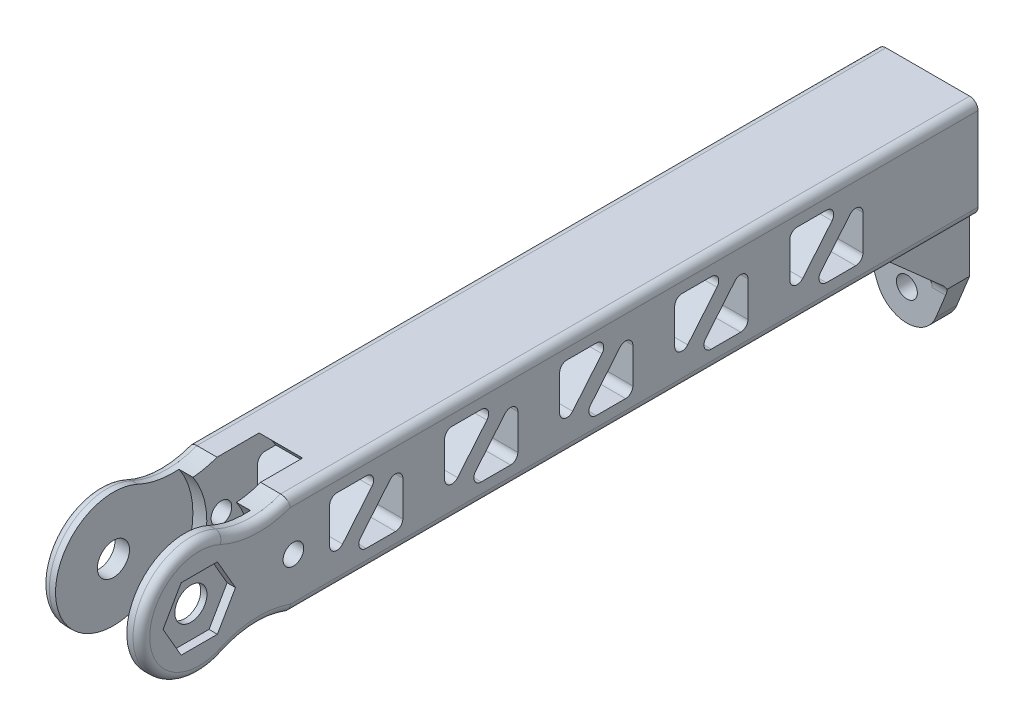
from build123d import *

# Parameters (mm, degrees)
SKETCH1_R               = 8.7884
SKETCH1_R_2             = 2.4384
SKETCH1_W               = 104.5923556
SKETCH1_H               = 15.24
BOSS_EXTRUDE1_DEPTH     = 15.24
SKETCH2_R               = 4.826
CUT_EXTRUDE1_DEPTH      = 12.7
CUT_EXTRUDE2_DEPTH      = 121.31407052
CUT_EXTRUDE2_DEPTH_BACK = 121.31407052
SKETCH3_W               = 10.8204
SKETCH3_H               = 19.05
CUT_EXTRUDE4_DEPTH      = 5.4102
CUT_EXTRUDE4_DEPTH_BACK = 5.4102
SKETCH5_R               = 12.065
CUT_EXTRUDE6_DEPTH      = 120.513496933
FILLET3_R               = 1.27
SKETCH10_W              = 12.7
SKETCH10_H              = 3.175
BOSS_EXTRUDE2_DEPTH     = 20.066
SKETCH11_R              = 1.5875
CUT_EXTRUDE7_DEPTH      = 128.794377122
CUT_EXTRUDE8_DEPTH      = 3.302
CUT_EXTRUDE8_DEPTH_BACK = 3.302
SKETCH12_R              = 9.525
CUT_EXTRUDE9_DEPTH      = 121.826660783
CUT_EXTRUDE9_DEPTH_BACK = 121.826660783
SKETCH12_3_R            = 1.56718
BOSS_EXTRUDE3_DEPTH     = 2.54
FILLET4_R               = 2.54
CUT_EXTRUDE11_DEPTH     = 1.27


with BuildPart() as part:
    # Sketch1 → Boss-Extrude1 (new body)
    # profile 1 of 3: a face of its own
    with BuildSketch(Plane(origin=(0, 0, 0), x_dir=(0, 0, -1), z_dir=(1, 0, 0))):
        Circle(SKETCH1_R)
        with Locations(Location((0, 0, 0), (0, 0, 180))):
            Circle(SKETCH1_R_2, mode=Mode.SUBTRACT)
    # profile 2 of 3: a face of its own
    with BuildSketch(Plane(origin=(0, 0, 0), x_dir=(0, 0, -1), z_dir=(1, 0, 0))):
        with BuildLine():
            Line((13.6192444, -7.62), (13.6192444, 7.62))
            ThreePointArc((13.6192444, 7.62), (8.629919404, 6.786434437), (3.71100259, 7.966456825))
            ThreePointArc((3.71100259, 7.966456825), (7.41113182, 4.723462681), (8.7884, 0))
            ThreePointArc((8.7884, 0), (7.41113182, -4.723462681), (3.71100259, -7.966456825))
            ThreePointArc((3.71100259, -7.966456825), (8.629919404, -6.786434437), (13.6192444, -7.62))
        make_face()
    # profile 3 of 3: a face of its own
    with BuildSketch(Plane(origin=(0, 0, 0), x_dir=(0, 0, -1), z_dir=(1, 0, 0))):
        with Locations((65.9154222, 0)):
            Rectangle(SKETCH1_W, SKETCH1_H)
    extrude(amount=BOSS_EXTRUDE1_DEPTH)

    # Sketch2 → Cut-Extrude1 (cut)
    with BuildSketch(Plane(origin=(0, 0, -118.2116), x_dir=(-1, 0, 0), z_dir=(0, 0, -1))):
        with Locations((-7.62, 0)):
            Circle(SKETCH2_R)
    extrude(amount=-CUT_EXTRUDE1_DEPTH, mode=Mode.SUBTRACT)

    # Sketch3 → Cut-Extrude2 (cut, two sides: drawn at the far end of the back side and taken through both)
    with BuildSketch(Plane(origin=(0, 7.62, 0), x_dir=(1, 0, 0), z_dir=(0, 1, 0)).offset(-CUT_EXTRUDE2_DEPTH_BACK)):
        with Locations((7.62, -0.6682556)):
            Rectangle(SKETCH3_W, SKETCH3_H)
    extrude(amount=CUT_EXTRUDE2_DEPTH + CUT_EXTRUDE2_DEPTH_BACK, mode=Mode.SUBTRACT)

    # Sketch5 → Cut-Extrude4 (cut, two sides: drawn at the far end of the back side and taken through both)
    with BuildSketch(Plane.ZY.offset(-7.62).offset(-CUT_EXTRUDE4_DEPTH_BACK)):
        Circle(SKETCH5_R)
    extrude(amount=CUT_EXTRUDE4_DEPTH + CUT_EXTRUDE4_DEPTH_BACK, mode=Mode.SUBTRACT)

    # Sketch6 → Cut-Extrude6 (cut, through all)
    with BuildSketch(Plane.ZY):
        with BuildLine():
            Line((-94.330479095, -2.939845086), (-98.784164103, 2.404576924))
            ThreePointArc((-98.784164103, 2.404576924), (-100.016147574, 2.7380488), (-100.7491, 1.69317201))
            Line((-100.7491, 1.69317201), (-100.7491, -3.65125))
            ThreePointArc((-100.7491, -3.65125), (-100.423622411, -4.437022411), (-99.63785, -4.7625))
            Line((-99.63785, -4.7625), (-95.184164992, -4.7625))
            ThreePointArc((-95.184164992, -4.7625), (-94.177828748, -4.122592684), (-94.330479095, -2.939845086))
        make_face()
        with BuildLine():
            ThreePointArc((-95.201535008, 4.7625), (-96.207871252, 4.122592684), (-96.055220905, 2.939845086))
            Line((-96.055220905, 2.939845086), (-91.601535897, -2.404576924))
            ThreePointArc((-91.601535897, -2.404576924), (-90.369552426, -2.7380488), (-89.6366, -1.69317201))
            Line((-89.6366, -1.69317201), (-89.6366, 3.65125))
            ThreePointArc((-89.6366, 3.65125), (-89.962077589, 4.437022411), (-90.74785, 4.7625))
            Line((-90.74785, 4.7625), (-95.201535008, 4.7625))
        make_face()
        with BuildLine():
            Line((-83.2866, 1.69317201), (-83.2866, -3.65125))
            ThreePointArc((-83.2866, -3.65125), (-82.961122411, -4.437022411), (-82.17535, -4.7625))
            Line((-82.17535, -4.7625), (-77.721664992, -4.7625))
            ThreePointArc((-77.721664992, -4.7625), (-76.715328748, -4.122592684), (-76.867979095, -2.939845086))
            Line((-76.867979095, -2.939845086), (-81.321664103, 2.404576924))
            ThreePointArc((-81.321664103, 2.404576924), (-82.553647574, 2.7380488), (-83.2866, 1.69317201))
        make_face()
        with BuildLine():
            ThreePointArc((-72.1741, 3.65125), (-72.499577589, 4.437022411), (-73.28535, 4.7625))
            Line((-73.28535, 4.7625), (-77.739035008, 4.7625))
            ThreePointArc((-77.739035008, 4.7625), (-78.745371252, 4.122592684), (-78.592720905, 2.939845086))
            Line((-78.592720905, 2.939845086), (-74.139035897, -2.404576924))
            ThreePointArc((-74.139035897, -2.404576924), (-72.907052426, -2.7380488), (-72.1741, -1.69317201))
            Line((-72.1741, -1.69317201), (-72.1741, 3.65125))
        make_face()
        with BuildLine():
            Line((-65.8241, 1.69317201), (-65.8241, -3.65125))
            ThreePointArc((-65.8241, -3.65125), (-65.498622411, -4.437022411), (-64.71285, -4.7625))
            Line((-64.71285, -4.7625), (-60.259164992, -4.7625))
            ThreePointArc((-60.259164992, -4.7625), (-59.252828748, -4.122592684), (-59.405479095, -2.939845086))
            Line((-59.405479095, -2.939845086), (-63.859164103, 2.404576924))
            ThreePointArc((-63.859164103, 2.404576924), (-65.091147574, 2.7380488), (-65.8241, 1.69317201))
        make_face()
        with BuildLine():
            ThreePointArc((-54.7116, 3.65125), (-55.037077589, 4.437022411), (-55.82285, 4.7625))
            Line((-55.82285, 4.7625), (-60.276535008, 4.7625))
            ThreePointArc((-60.276535008, 4.7625), (-61.282871252, 4.122592684), (-61.130220905, 2.939845086))
            Line((-61.130220905, 2.939845086), (-56.676535897, -2.404576924))
            ThreePointArc((-56.676535897, -2.404576924), (-55.444552426, -2.7380488), (-54.7116, -1.69317201))
            Line((-54.7116, -1.69317201), (-54.7116, 3.65125))
        make_face()
        with BuildLine():
            Line((-48.3616, 1.69317201), (-48.3616, -3.65125))
            ThreePointArc((-48.3616, -3.65125), (-48.036122411, -4.437022411), (-47.25035, -4.7625))
            Line((-47.25035, -4.7625), (-42.796664992, -4.7625))
            ThreePointArc((-42.796664992, -4.7625), (-41.790328748, -4.122592684), (-41.942979095, -2.939845086))
            Line((-41.942979095, -2.939845086), (-46.396664103, 2.404576924))
            ThreePointArc((-46.396664103, 2.404576924), (-47.628647574, 2.7380488), (-48.3616, 1.69317201))
        make_face()
        with BuildLine():
            ThreePointArc((-37.2491, 3.65125), (-37.574577589, 4.437022411), (-38.36035, 4.7625))
            Line((-38.36035, 4.7625), (-42.814035008, 4.7625))
            ThreePointArc((-42.814035008, 4.7625), (-43.820371252, 4.122592684), (-43.667720905, 2.939845086))
            Line((-43.667720905, 2.939845086), (-39.214035897, -2.404576924))
            ThreePointArc((-39.214035897, -2.404576924), (-37.982052426, -2.7380488), (-37.2491, -1.69317201))
            Line((-37.2491, -1.69317201), (-37.2491, 3.65125))
        make_face()
        with BuildLine():
            Line((-30.8991, 1.69317201), (-30.8991, -3.65125))
            ThreePointArc((-30.8991, -3.65125), (-30.573622411, -4.437022411), (-29.78785, -4.7625))
            Line((-29.78785, -4.7625), (-25.334164992, -4.7625))
            ThreePointArc((-25.334164992, -4.7625), (-24.327828748, -4.122592684), (-24.480479095, -2.939845086))
            Line((-24.480479095, -2.939845086), (-28.934164103, 2.404576924))
            ThreePointArc((-28.934164103, 2.404576924), (-30.166147574, 2.7380488), (-30.8991, 1.69317201))
        make_face()
        with BuildLine():
            ThreePointArc((-19.7866, 3.65125), (-20.112077589, 4.437022411), (-20.89785, 4.7625))
            Line((-20.89785, 4.7625), (-25.351535008, 4.7625))
            ThreePointArc((-25.351535008, 4.7625), (-26.357871252, 4.122592684), (-26.205220905, 2.939845086))
            Line((-26.205220905, 2.939845086), (-21.751535897, -2.404576924))
            ThreePointArc((-21.751535897, -2.404576924), (-20.519552426, -2.7380488), (-19.7866, -1.69317201))
            Line((-19.7866, -1.69317201), (-19.7866, 3.65125))
        make_face()
    extrude(amount=-CUT_EXTRUDE6_DEPTH, mode=Mode.SUBTRACT)

    # Fillet3
    fillet3_edges = [part.edges().sort_by_distance(p)[0] for p in [
        (0, -7.62, -65.9154222),
        (0, -6.786434437, -8.629919404),
        (15.24, 0, 8.7884),
        (0, 0, 8.7884),
        (15.24, -6.786434437, -8.629919404),
        (15.24, -7.62, -65.9154222),
        (15.24, 7.62, -65.9154222),
        (15.24, 6.786434437, -8.629919404),
        (0, 6.786434437, -8.629919404),
        (0, 7.62, -65.9154222),
    ]]
    fillet(fillet3_edges, radius=FILLET3_R)

    # Sketch10 → Boss-Extrude2 (add)
    with BuildSketch(Plane.XZ.offset(7.62)):
        with Locations((7.62, -116.6241)):
            Rectangle(SKETCH10_W, SKETCH10_H)
    extrude(amount=BOSS_EXTRUDE2_DEPTH)

    # Sketch11 → Cut-Extrude7 (cut, through all)
    with BuildSketch(Plane.XY.offset(-115.0366)):
        with BuildLine():
            Line((3.206815875, -20.840310625), (1.27, -16.065985457))
            Line((1.27, -16.065985457), (1.27, -27.686))
            Line((1.27, -27.686), (13.97, -27.686))
            Line((13.97, -27.686), (13.97, -16.065985457))
            Line((13.97, -16.065985457), (12.033184125, -20.840310625))
            ThreePointArc((12.033184125, -20.840310625), (7.62, -23.8125), (3.206815875, -20.840310625))
        make_face()
        with Locations((7.62, -19.05)):
            Circle(SKETCH11_R)
    extrude(amount=-CUT_EXTRUDE7_DEPTH, mode=Mode.SUBTRACT)

    # Sketch12 → Cut-Extrude8 (cut, two sides: drawn at the far end of the back side and taken through both)
    with BuildSketch(Plane.ZY.offset(-7.62).offset(-CUT_EXTRUDE8_DEPTH_BACK)):
        with Locations((-14.2875, 0)):
            Circle(SKETCH12_R)
    extrude(amount=CUT_EXTRUDE8_DEPTH + CUT_EXTRUDE8_DEPTH_BACK, mode=Mode.SUBTRACT)

    # Sketch12<3> → Cut-Extrude9 (cut, two sides: drawn at the far end of the back side and taken through both)
    with BuildSketch(Plane.ZY.offset(-7.62).offset(-CUT_EXTRUDE9_DEPTH_BACK)):
        with Locations((-14.2875, 0)):
            Circle(SKETCH12_3_R)
    extrude(amount=CUT_EXTRUDE9_DEPTH + CUT_EXTRUDE9_DEPTH_BACK, mode=Mode.SUBTRACT)

    # Sketch13 → Boss-Extrude3 (add)
    with BuildSketch(Plane(origin=(13.97, 0, 0), x_dir=(0, 0, -1), z_dir=(1, 0, 0))):
        Polygon((115.0366, -16.065985457), (105.5116, -7.62), (115.0366, -7.62), align=None)
    boss_extrude3 = extrude(amount=-BOSS_EXTRUDE3_DEPTH)

    # Mirror3: Boss-Extrude3 across plane
    add(boss_extrude3.mirror(Plane.ZY.offset(-7.62)))

    # Fillet4
    # the kernel refuses this fillet: 2.54 mm, written as the material it adds along each edge
    with BuildSketch(Plane(origin=(13.97, -16.065985457, -115.0366), x_dir=(0, -1, 0), z_dir=(-1, 0, 0))) as fillet4_piece_1_section:
        with BuildLine():
            CenterArc((FILLET4_R * 0.449795801434, FILLET4_R), FILLET4_R, 221.563969838, 48.436030162)
            Line((-FILLET4_R * 0.298419647829, FILLET4_R * 0.336544167647), (0, 0))
            Line((0, 0), (FILLET4_R * 0.449795801434, 0))
        make_face()
    fillet4_piece_1 = extrude(amount=2.54, mode=Mode.PRIVATE)
    fillet4_piece_1 = split(fillet4_piece_1, bisect_by=Plane(origin=(13.76290933, -16.576471874, -114.848657268), z_dir=(-0.9266528345458832, 0.37591824141438, 0)), keep=Keep.TOP, mode=Mode.PRIVATE)
    add(fillet4_piece_1)
    with BuildSketch(Plane(origin=(13.97, -7.62, -105.5116), x_dir=(0, -0.6634558323534353, -0.7482154492632523), z_dir=(-1, 0, 0))) as fillet4_piece_2:
        with BuildLine():
            CenterArc((FILLET4_R * 0.379504615769, FILLET4_R), FILLET4_R, 228.436030162, 41.563969838)
            Line((-FILLET4_R * 0.283951216585, FILLET4_R * 0.251784550737), (0, 0))
            Line((0, 0), (FILLET4_R * 0.379504615769, 0))
        make_face()
    extrude(amount=2.54)
    with BuildSketch(Plane(origin=(1.27, -16.065985457, -115.0366), x_dir=(0, -1, 0), z_dir=(1, 0, 0))) as fillet4_piece_3_section:
        with BuildLine():
            CenterArc((FILLET4_R * 0.449795801434, -FILLET4_R), FILLET4_R, 90, 48.436030162)
            Line((-FILLET4_R * 0.298419647829, -FILLET4_R * 0.336544167647), (0, 0))
            Line((0, 0), (FILLET4_R * 0.449795801434, 0))
        make_face()
    fillet4_piece_3 = extrude(amount=2.54, mode=Mode.PRIVATE)
    fillet4_piece_3 = split(fillet4_piece_3, bisect_by=Plane(origin=(1.47709067, -16.576471874, -114.848657268), z_dir=(0.9266528345458829, 0.3759182414143808, 0)), keep=Keep.TOP, mode=Mode.PRIVATE)
    add(fillet4_piece_3)
    with BuildSketch(Plane(origin=(1.27, -7.62, -105.5116), x_dir=(0, -0.6634558323534353, -0.7482154492632523), z_dir=(1, 0, 0))) as fillet4_piece_4:
        with BuildLine():
            CenterArc((FILLET4_R * 0.379504615769, -FILLET4_R), FILLET4_R, 90, 41.563969838)
            Line((-FILLET4_R * 0.283951216585, -FILLET4_R * 0.251784550737), (0, 0))
            Line((0, 0), (FILLET4_R * 0.379504615769, 0))
        make_face()
    extrude(amount=2.54)

    # Sketch14 → Cut-Extrude11 (cut)
    with BuildSketch(Plane(origin=(15.24, 0, 0), x_dir=(0, 0, -1), z_dir=(1, 0, 0))):
        Polygon((-2.749630657, -4.7625), (2.749630657, -4.7625), (5.499261314, 0), (2.749630657, 4.7625), (-2.749630657, 4.7625), (-5.499261314, 0), align=None)
    extrude(amount=-CUT_EXTRUDE11_DEPTH, mode=Mode.SUBTRACT)


solid = part.part
